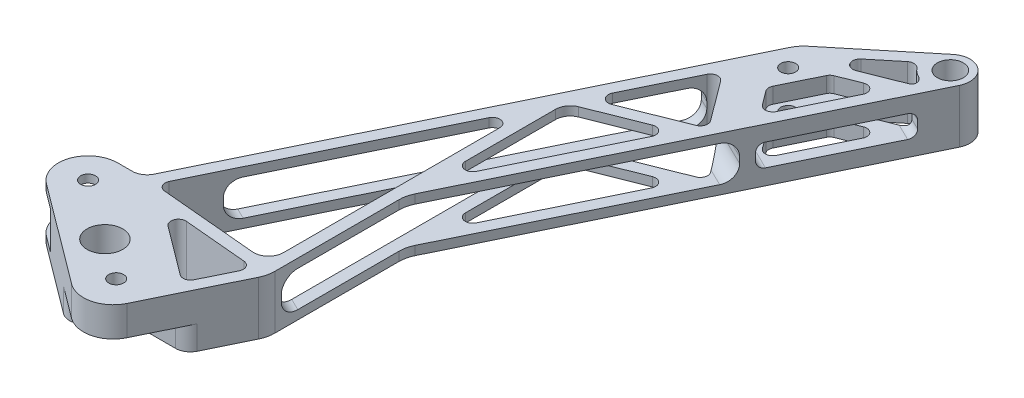
from build123d import *

# Parameters (mm, degrees)
SKETCH1_R               = 3.175
SKETCH1_R_2             = 5.5372
BOSS_EXTRUDE1_DEPTH     = 22.86
CUT_EXTRUDE1_DEPTH      = 8.059928
CUT_EXTRUDE2_DEPTH      = 10.16
CUT_EXTRUDE4_DEPTH      = 282.653637116
CUT_EXTRUDE4_DEPTH_BACK = 282.653637116
SKETCH10_R              = 7.62
FILLET1_R               = 3.175
FILLET2_R               = 12.7
SKETCH11_W              = 154.431730967
SKETCH11_H              = 15.24
CUT_EXTRUDE5_DEPTH      = 111.76
FILLET5_R               = 6.35
SKETCH12_W              = 51.766158773
SKETCH12_H              = 9.525
CUT_EXTRUDE6_DEPTH      = 43.18
FILLET8_R               = 6.35
FILLET7_R               = 6.35
FILLET4_R               = 3.175


with BuildPart() as part:
    # Sketch1 → Boss-Extrude1 (new body)
    with BuildSketch(Plane(origin=(0, 0, 0), x_dir=(1, 0, 0), z_dir=(0, 1, 0))):
        with BuildLine():
            Line((-80.589923656, 44.45), (-70.440646012, 44.45))
            Line((-70.440646012, 44.45), (21.397610809, 233.122630111))
            Line((21.397610809, 233.122630111), (57.58321106, 262.870731575))
            ThreePointArc((57.58321106, 262.870731575), (68.054170152, 262.976534601), (70.39009169, 252.768907592))
            Line((70.39009169, 252.768907592), (-6.976218517, 93.827462773))
            Line((-6.976218517, 93.827462773), (-6.976218517, 34.923071285))
            Line((-6.976218517, 34.923071285), (-26.68094252, -5.558338445))
            ThreePointArc((-26.68094252, -5.558338445), (-35.105440841, -12.341904855), (-45.701991473, -10.173481491))
            Line((-45.701991473, -10.173481491), (-88.191915129, 21.576518509))
            ThreePointArc((-88.191915129, 21.576518509), (-92.641753702, 35.755420394), (-80.589923656, 44.45))
        make_face()
        with Locations(Location((-80.589923656, 31.75, 0), (0, 0, 270))):
            Circle(SKETCH1_R, mode=Mode.SUBTRACT)
        with Locations(Location((27.324381978, 222.747274088, 0), (0, 0, 270))):
            Circle(SKETCH1_R, mode=Mode.SUBTRACT)
        with Locations(Location((62.884381978, 256.422385554, 0), (0, 0, 270))):
            Circle(SKETCH1_R_2, mode=Mode.SUBTRACT)
        with Locations(Location((-38.1, 1.27, 0), (0, 0, 270))):
            Circle(SKETCH1_R, mode=Mode.SUBTRACT)
    extrude(amount=BOSS_EXTRUDE1_DEPTH)

    # Sketch2 → Cut-Extrude1 (cut, symmetric)
    with BuildSketch(Plane(origin=(0, 11.43, 0), x_dir=(-1, 0, 0), z_dir=(0, -1, 0))):
        Polygon((93.289923656, 16.51), (119.123736833, 16.51), (119.123736833, 65.67419432), (65.349923656, 65.67419432), (65.349923656, 44.45), (65.349923656, 16.51), align=None)
    extrude(amount=CUT_EXTRUDE1_DEPTH, both=True, mode=Mode.SUBTRACT)

    # Sketch4 → Cut-Extrude2 (cut)
    with BuildSketch(Plane(origin=(0, 0, 0), x_dir=(-1, 0, 0), z_dir=(0, -1, 0))):
        with BuildLine():
            Line((38.1, 11.049), (10.895356426, 11.049))
            Line((10.895356426, 11.049), (13.015333537, -21.264348886))
            Line((13.015333537, -21.264348886), (62.52493537, -15.080100936))
            Line((62.52493537, -15.080100936), (45.933580748, 7.123533434))
            ThreePointArc((45.933580748, 7.123533434), (42.481046539, 10.012726819), (38.1, 11.049))
        make_face()
    extrude(amount=-CUT_EXTRUDE2_DEPTH, mode=Mode.SUBTRACT)

    # Sketch10 → Cut-Extrude4 (cut, two sides: drawn at the far end of the back side and taken through both)
    with BuildSketch(Plane(origin=(0, 0, 0), x_dir=(-1, 0, 0), z_dir=(0, -1, 0)).offset(-CUT_EXTRUDE4_DEPTH_BACK)):
        with Locations(Location((55.157266564, 13.505971264, 0), (0, 0, 90))):
            Circle(SKETCH10_R)
        Polygon((-14.646962201, 207.647023349), (4.411562958, 168.493165335), (-32.832080676, 183.27657607), align=None)
        Polygon((6.976218517, 162.009587324), (-27.157299952, 175.558471755), (6.976218517, 105.434528561), align=None)
        Polygon((12.056218517, 152.787975357), (12.056218517, 39.688996738), (64.790792676, 44.45), align=None)
        Polygon((55.498233326, 38.510384262), (12.758160388, 34.651708433), (22.780244725, 14.062325788), align=None)
        with BuildLine():
            Line((-61.612056248, 246.342366346), (-59.962110445, 242.952715618))
            Line((-59.962110445, 242.952715618), (-23.981724677, 228.670739707))
            Line((-23.981724677, 228.670739707), (-53.37792621, 252.837291589))
            ThreePointArc((-53.37792621, 252.837291589), (-56.592200629, 248.445289975), (-61.612056248, 246.342366346))
        make_face()
        Polygon((-38.905525657, 229.12899152), (-56.66456004, 236.178223924), (-38.705073744, 199.282232731), (-30.03379154, 210.902889813), align=None)
    extrude(amount=CUT_EXTRUDE4_DEPTH + CUT_EXTRUDE4_DEPTH_BACK, mode=Mode.SUBTRACT)

    # Fillet1
    # the kernel refuses this fillet: 3.175 mm, written as the material it adds along each edge
    with BuildSketch(Plane(origin=(-55.498233326, 0, -38.510384262), x_dir=(0.8010615347003324, 0, 0.5985820057632439), z_dir=(0, 1, 0))) as fillet1_piece_1:
        with BuildLine():
            CenterArc((FILLET1_R * 3.5327959948, FILLET1_R), FILLET1_R, 121.609594884, 148.390405116)
            Line((FILLET1_R * 3.00866746401, FILLET1_R * 1.85163917431), (0, 0))
            Line((0, 0), (FILLET1_R * 3.5327959948, 0))
        make_face()
    extrude(amount=22.86)
    with BuildSketch(Plane(origin=(-12.758160388, 22.86, -34.651708433), x_dir=(-0.43766444449958003, 0, 0.8991383842439794), z_dir=(0, -1, 0)), Plane(origin=(-64.790792676, 0, -44.45), x_dir=(0.9959492912174563, 0, 0.08991667989559035), z_dir=(0, 1, 0))) as fillet1_piece_2:
        with BuildLine():
            CenterArc((FILLET1_R * 1.44947818144, FILLET1_R), FILLET1_R, 159.203855566, 110.796144434)
            Line((FILLET1_R * 0.514628611192, FILLET1_R * 1.35504405501), (0, 0))
            Line((0, 0), (FILLET1_R * 1.44947818144, 0))
        make_face()
    extrude(amount=22.86)
    with BuildSketch(Plane(origin=(-12.056218517, 0, -152.787975357), x_dir=(-0.43766444449965153, 0, 0.8991383842439447), z_dir=(0, 1, 0)), Plane(origin=(-6.976218517, 0, -105.434528561), x_dir=(0.4376644444995801, 0, -0.8991383842439794), z_dir=(0, 1, 0))) as fillet1_piece_3:
        with BuildLine():
            CenterArc((FILLET1_R * 4.33925672536, FILLET1_R), FILLET1_R, 115.9549582, 154.0450418)
            Line((FILLET1_R * 3.90159228086, FILLET1_R * 1.89913838424), (0, 0))
            Line((0, 0), (FILLET1_R * 4.33925672536, 0))
        make_face()
    extrude(amount=22.86)
    with BuildSketch(Plane(origin=(27.157299952, 22.86, -175.558471755), x_dir=(-0.43766444449958014, 0, 0.8991383842439794), z_dir=(0, -1, 0)), Plane(origin=(56.66456004, 22.86, -236.178223924), x_dir=(-0.4376644444995795, 0, 0.8991383842439797), z_dir=(0, -1, 0))) as fillet1_piece_4:
        with BuildLine():
            CenterArc((FILLET1_R * 2.57848482078, FILLET1_R), FILLET1_R, 132.3950418, 137.6049582)
            Line((FILLET1_R * 1.90424633937, FILLET1_R * 1.73851368991), (0, 0))
            Line((0, 0), (FILLET1_R * 2.57848482078, 0))
        make_face()
    extrude(amount=22.86)
    with BuildSketch(Plane(origin=(14.646962201, 22.86, -207.647023349), x_dir=(-0.4376644444995807, 0, 0.8991383842439792), z_dir=(0, -1, 0)), Plane(origin=(38.705073744, 22.86, -199.282232731), x_dir=(0.4376644444995798, 0, -0.8991383842439795), z_dir=(0, -1, 0))) as fillet1_piece_5:
        with BuildLine():
            CenterArc((FILLET1_R * 1.64196311223, -FILLET1_R), FILLET1_R, 90, 117.314906878)
            Line((FILLET1_R * 0.75346523839, -FILLET1_R * 1.45888073415), (0, 0))
            Line((0, 0), (FILLET1_R * 1.64196311223, 0))
        make_face()
    extrude(amount=22.86)
    with BuildSketch(Plane(origin=(32.832080676, 22.86, -183.27657607), x_dir=(-0.5980467610887682, 0, -0.8014612102598814), z_dir=(0, -1, 0))) as fillet1_piece_6:
        with BuildLine():
            CenterArc((FILLET1_R * 1.30511410765, -FILLET1_R), FILLET1_R, 90, 105.080134922)
            Line((FILLET1_R * 0.339551215013, -FILLET1_R * 1.26016975299), (0, 0))
            Line((0, 0), (FILLET1_R * 1.30511410765, 0))
        make_face()
    extrude(amount=22.86)
    with BuildSketch(Plane(origin=(-4.411562958, 0, -168.493165335), x_dir=(0.43766444449958, 0, -0.8991383842439794), z_dir=(0, 1, 0))) as fillet1_piece_7:
        with BuildLine():
            CenterArc((FILLET1_R * 2.57848482078, -FILLET1_R), FILLET1_R, 90, 137.6049582)
            Line((FILLET1_R * 1.90424633937, -FILLET1_R * 1.73851368991), (0, 0))
            Line((0, 0), (FILLET1_R * 2.57848482078, 0))
        make_face()
    extrude(amount=22.86)
    with BuildSketch(Plane(origin=(-22.780244725, 0, -14.062325788), x_dir=(0.4376644444995798, 0, -0.8991383842439795), z_dir=(0, 1, 0))) as fillet1_piece_8:
        with BuildLine():
            CenterArc((FILLET1_R * 1.20908127799, FILLET1_R), FILLET1_R, 169.18654955, 100.81345045)
            Line((FILLET1_R * 0.226838042957, FILLET1_R * 1.1876119059), (0, 0))
            Line((0, 0), (FILLET1_R * 1.20908127799, 0))
        make_face()
    extrude(amount=22.86)
    with BuildSketch(Plane(origin=(59.962110445, 22.86, -242.952715618), x_dir=(0.43766444449958136, 0, -0.8991383842439788), z_dir=(0, -1, 0))) as fillet1_piece_9:
        with BuildLine():
            CenterArc((FILLET1_R * 0.387824660413, -FILLET1_R), FILLET1_R, 90, 42.3950418)
            Line((-FILLET1_R * 0.286413820999, -FILLET1_R * 0.261486310091), (0, 0))
            Line((0, 0), (FILLET1_R * 0.387824660413, 0))
        make_face()
    extrude(amount=22.86)
    with BuildSketch(Plane(origin=(53.37792621, 0, -252.837291589), x_dir=(0.49763977828334227, 0, 0.8673837968685524), z_dir=(0, 1, 0)), Plane(origin=(61.612056248, 22.86, -246.342366346), x_dir=(-0.9594351985797201, 0, -0.2819292459577281), z_dir=(0, -1, 0))) as fillet1_piece_10:
        with BuildLine():
            CenterArc((3.748881914, -3.134322208), FILLET1_R, 99.181406679, 90.398169584)
            Line((0.618155952, -3.662697029), (0, 0))
            ThreePointArc((0, 0), (1.621138125, -0.130168936), (3.24227625, 0))
        make_face()
    extrude(amount=22.86)
    with BuildSketch(Plane(origin=(23.981724677, 0, -228.670739707), x_dir=(0.9294548826213175, 0, -0.3689357954595799), z_dir=(0, 1, 0))) as fillet1_piece_11:
        with BuildLine():
            CenterArc((FILLET1_R * 6.39552501083, FILLET1_R), FILLET1_R, 107.773547716, 162.226452284)
            Line((FILLET1_R * 6.09026931702, FILLET1_R * 1.95227042451), (0, 0))
            Line((0, 0), (FILLET1_R * 6.39552501083, 0))
        make_face()
    extrude(amount=22.86)
    with BuildSketch(Plane(origin=(30.03379154, 0, -210.902889813), x_dir=(0.5980467610887678, 0, 0.8014612102598817), z_dir=(0, 1, 0))) as fillet1_piece_12:
        with BuildLine():
            CenterArc((FILLET1_R * 0.609027080176, FILLET1_R), FILLET1_R, 207.314906878, 62.685093122)
            Line((-FILLET1_R * 0.279470793669, FILLET1_R * 0.541119265849), (0, 0))
            Line((0, 0), (FILLET1_R * 0.609027080176, 0))
        make_face()
    extrude(amount=22.86)
    with BuildSketch(Plane(origin=(38.905525657, 0, -229.12899152), x_dir=(-0.4376644444995767, 0, 0.8991383842439811), z_dir=(0, 1, 0))) as fillet1_piece_13:
        with BuildLine():
            CenterArc((FILLET1_R * 0.387824660413, FILLET1_R), FILLET1_R, 227.6049582, 42.3950418)
            Line((-FILLET1_R * 0.286413820999, FILLET1_R * 0.261486310091), (0, 0))
            Line((0, 0), (FILLET1_R * 0.387824660413, 0))
        make_face()
    extrude(amount=22.86)

    # Fillet2
    fillet2_edges = [part.edges().sort_by_distance(p)[0] for p in [
        (21.397610809, 11.43, -233.122630111),
        (-6.976218517, 11.43, -93.827462773),
        (-6.976218517, 11.43, -34.923071285),
    ]]
    fillet(fillet2_edges, radius=FILLET2_R)

    # Sketch11 → Cut-Extrude5 (cut)
    with BuildSketch(Plane(origin=(-74.439732647, 0, -36.234271396), x_dir=(-0.4376644444995802, 0, 0.8991383842439794), z_dir=(-0.8991383842439795, 0, -0.43766444449958025))):
        with Locations((-110.684765278, 11.43)):
            Rectangle(SKETCH11_W, SKETCH11_H)
    extrude(amount=-CUT_EXTRUDE5_DEPTH, mode=Mode.SUBTRACT)

    # Fillet5
    # the kernel refuses this fillet: 6.35 mm, written as the material it adds along each edge
    with BuildSketch(Plane(origin=(-59.791585211, 19.05, -66.327443879), x_dir=(0, -1, 0), z_dir=(0.8991383842439794, 0, 0.43766444449958025)), Plane(origin=(-59.791585211, 3.81, -66.327443879), x_dir=(0.43766444449958025, 0, -0.8991383842439794), z_dir=(0.8991383842439794, 0, 0.43766444449958025)), Plane(origin=(7.797692536, 3.81, -205.182940937), x_dir=(0, 1, 0), z_dir=(0.8991383842439794, 0, 0.43766444449958025))) as fillet5_piece_1:
        with BuildLine():
            CenterArc((FILLET5_R, FILLET5_R), FILLET5_R, 180, 90)
            Line((0, FILLET5_R), (0, 0))
            Line((0, 0), (FILLET5_R, 0))
        make_face()
    extrude(amount=5.08)
    with BuildSketch(Plane(origin=(7.797692536, 19.05, -205.182940937), x_dir=(0, -1, 0), z_dir=(0.8991383842439794, 0, 0.43766444449958025))) as fillet5_piece_2:
        with BuildLine():
            CenterArc((FILLET5_R, -FILLET5_R), FILLET5_R, 90, 90)
            Line((0, -FILLET5_R), (0, 0))
            Line((0, 0), (FILLET5_R, 0))
        make_face()
    extrude(amount=5.08)
    with BuildSketch(Plane(origin=(-6.476129314, 19.05, -212.130863994), x_dir=(0, -1, 0), z_dir=(0.8991383842439794, 0, 0.43766444449958025))) as fillet5_piece_3_section:
        with BuildLine():
            CenterArc((FILLET5_R, -FILLET5_R), FILLET5_R, 90, 90)
            Line((0, -FILLET5_R), (0, 0))
            Line((0, 0), (FILLET5_R, 0))
        make_face()
    fillet5_piece_3 = extrude(amount=36.83, mode=Mode.PRIVATE)
    fillet5_piece_3 = split(fillet5_piece_3, bisect_by=Plane(origin=(23.562712539, 17.205322892, -195.698746858), z_dir=(0.8014612102598819, 0, -0.5980467610887676)), keep=Keep.TOP, mode=Mode.PRIVATE)
    add(fillet5_piece_3)
    with BuildSketch(Plane(origin=(-6.476129314, 3.81, -212.130863994), x_dir=(0, 1, 0), z_dir=(0.8991383842439794, 0, 0.43766444449958025))) as fillet5_piece_4_section:
        with BuildLine():
            CenterArc((FILLET5_R, FILLET5_R), FILLET5_R, 180, 90)
            Line((0, FILLET5_R), (0, 0))
            Line((0, 0), (FILLET5_R, 0))
        make_face()
    fillet5_piece_4 = extrude(amount=36.83, mode=Mode.PRIVATE)
    fillet5_piece_4 = split(fillet5_piece_4, bisect_by=Plane(origin=(23.562712539, 5.654677108, -195.698746858), z_dir=(0.8014612102598819, 0, -0.5980467610887676)), keep=Keep.TOP, mode=Mode.PRIVATE)
    add(fillet5_piece_4)
    with BuildSketch(Plane(origin=(7.167404759, 19.05, -205.489739707), x_dir=(-0.4376644444995802, 0, 0.8991383842439794), z_dir=(0.8991383842439794, 0, 0.43766444449958025))) as fillet5_piece_5_section:
        with BuildLine():
            CenterArc((FILLET5_R, FILLET5_R), FILLET5_R, 180, 90)
            Line((0, FILLET5_R), (0, 0))
            Line((0, 0), (FILLET5_R, 0))
        make_face()
    fillet5_piece_5 = extrude(amount=52.028533826, mode=Mode.PRIVATE)
    fillet5_piece_5 = split(fillet5_piece_5, bisect_by=Plane(origin=(7.176915235, 17.631613588, -203.90761527), z_dir=(0.8991383842439794, 0, 0.4376644444995802)), keep=Keep.TOP, mode=Mode.PRIVATE)
    fillet5_piece_5 = split(fillet5_piece_5, bisect_by=Plane(origin=(11.744538227, 17.631613588, -201.684279892), z_dir=(-0.8991383842439794, 0, -0.4376644444995802)), keep=Keep.TOP, mode=Mode.PRIVATE)
    add(fillet5_piece_5)
    with BuildSketch(Plane(origin=(7.167404759, 19.05, -205.489739707), x_dir=(-0.4376644444995802, 0, 0.8991383842439794), z_dir=(0.8991383842439794, 0, 0.43766444449958025))) as fillet5_piece_6_section:
        with BuildLine():
            CenterArc((FILLET5_R, FILLET5_R), FILLET5_R, 180, 90)
            Line((0, FILLET5_R), (0, 0))
            Line((0, 0), (FILLET5_R, 0))
        make_face()
    fillet5_piece_6 = extrude(amount=36.153533826, mode=Mode.PRIVATE)
    fillet5_piece_6 = split(fillet5_piece_6, bisect_by=Plane(origin=(27.824250166, 17.539507709, -189.987726707), z_dir=(0.8014612102598819, 0, -0.5980467610887676)), keep=Keep.TOP, mode=Mode.PRIVATE)
    add(fillet5_piece_6)
    with BuildSketch(Plane(origin=(7.167404759, 3.81, -205.489739707), x_dir=(-0.4376644444995802, 0, 0.8991383842439793), z_dir=(0.8991383842439794, 0, 0.43766444449958025))) as fillet5_piece_7_section:
        with BuildLine():
            CenterArc((FILLET5_R, -FILLET5_R), FILLET5_R, 90, 90)
            Line((0, -FILLET5_R), (0, 0))
            Line((0, 0), (FILLET5_R, 0))
        make_face()
    fillet5_piece_7 = extrude(amount=52.028533826, mode=Mode.PRIVATE)
    fillet5_piece_7 = split(fillet5_piece_7, bisect_by=Plane(origin=(7.176915235, 5.228386412, -203.90761527), z_dir=(0.8991383842439794, 0, 0.4376644444995802)), keep=Keep.TOP, mode=Mode.PRIVATE)
    fillet5_piece_7 = split(fillet5_piece_7, bisect_by=Plane(origin=(11.744538227, 5.228386412, -201.684279892), z_dir=(-0.8991383842439794, 0, -0.4376644444995802)), keep=Keep.TOP, mode=Mode.PRIVATE)
    add(fillet5_piece_7)
    with BuildSketch(Plane(origin=(7.167404759, 3.81, -205.489739707), x_dir=(-0.4376644444995802, 0, 0.8991383842439793), z_dir=(0.8991383842439794, 0, 0.43766444449958025))) as fillet5_piece_8_section:
        with BuildLine():
            CenterArc((FILLET5_R, -FILLET5_R), FILLET5_R, 90, 90)
            Line((0, -FILLET5_R), (0, 0))
            Line((0, 0), (FILLET5_R, 0))
        make_face()
    fillet5_piece_8 = extrude(amount=36.153533826, mode=Mode.PRIVATE)
    fillet5_piece_8 = split(fillet5_piece_8, bisect_by=Plane(origin=(27.824250166, 5.320492291, -189.987726707), z_dir=(0.8014612102598819, 0, -0.5980467610887676)), keep=Keep.TOP, mode=Mode.PRIVATE)
    add(fillet5_piece_8)
    with BuildSketch(Plane(origin=(-12.056218517, 22.86, -39.688996738), x_dir=(0, 0, -1), z_dir=(0, -1, 0))) as fillet5_piece_9_section:
        with BuildLine():
            CenterArc((FILLET5_R * 1.09434957132, -FILLET5_R), FILLET5_R, 90, 95.158813766)
            Line((FILLET5_R * 0.0984002800978, -FILLET5_R * 1.0899166799), (0, 0))
            Line((0, 0), (FILLET5_R * 1.09434957132, 0))
        make_face()
    fillet5_piece_9 = extrude(amount=40.232799445, mode=Mode.PRIVATE)
    fillet5_piece_9 = split(fillet5_piece_9, bisect_by=Plane(origin=(-12.307720655, 19.05, -44.120451673), z_dir=(0, 1, 0)), keep=Keep.TOP, mode=Mode.PRIVATE)
    add(fillet5_piece_9)
    with BuildSketch(Plane(origin=(-12.056218517, 40.232799445, -39.688996738), x_dir=(0, 0, -1), z_dir=(0, -1, 0))) as fillet5_piece_10_section:
        with BuildLine():
            CenterArc((FILLET5_R * 1.09434957132, -FILLET5_R), FILLET5_R, 90, 95.158813766)
            Line((FILLET5_R * 0.0984002800978, -FILLET5_R * 1.0899166799), (0, 0))
            Line((0, 0), (FILLET5_R * 1.09434957132, 0))
        make_face()
    fillet5_piece_10 = extrude(amount=40.232799445, mode=Mode.PRIVATE)
    fillet5_piece_10 = split(fillet5_piece_10, bisect_by=Plane(origin=(-13.762155256, 19.05, -41.117735426), z_dir=(0, -1, 0)), keep=Keep.TOP, mode=Mode.PRIVATE)
    fillet5_piece_10 = split(fillet5_piece_10, bisect_by=Plane(origin=(-12.658553008, 11.43, -43.384977271), z_dir=(-0.43766444449958025, 0, 0.8991383842439794)), keep=Keep.TOP, mode=Mode.PRIVATE)
    add(fillet5_piece_10)
    with BuildSketch(Plane(origin=(-12.056218517, 40.232799445, -39.688996738), x_dir=(0, 0, -1), z_dir=(0, -1, 0))) as fillet5_piece_11_section:
        with BuildLine():
            CenterArc((FILLET5_R * 1.09434957132, -FILLET5_R), FILLET5_R, 90, 95.158813766)
            Line((FILLET5_R * 0.0984002800978, -FILLET5_R * 1.0899166799), (0, 0))
            Line((0, 0), (FILLET5_R * 1.09434957132, 0))
        make_face()
    fillet5_piece_11 = extrude(amount=40.232799445, mode=Mode.PRIVATE)
    fillet5_piece_11 = split(fillet5_piece_11, bisect_by=Plane(origin=(-12.307720655, 3.81, -44.120451673), z_dir=(0, -1, 0)), keep=Keep.TOP, mode=Mode.PRIVATE)
    add(fillet5_piece_11)
    with BuildSketch(Plane(origin=(-6.976218517, 19.05, -162.009587324), x_dir=(0.9294548826213174, 0, -0.36893579545958005), z_dir=(0, 1, 0)), Plane(origin=(-6.976218517, 0, -162.009587324), x_dir=(0.9294548826213174, 0, -0.36893579545958005), z_dir=(0, 1, 0))) as fillet5_piece_12:
        with BuildLine():
            CenterArc((FILLET5_R * 0.678961632608, -FILLET5_R), FILLET5_R, 90, 68.35)
            Line((-FILLET5_R * 0.250493250013, -FILLET5_R * 0.63106420454), (0, 0))
            Line((0, 0), (FILLET5_R * 0.678961632608, 0))
        make_face()
    extrude(amount=3.81)

    # Sketch12 → Cut-Extrude6 (cut)
    with BuildSketch(Plane(origin=(-74.439732647, 0, -36.234271396), x_dir=(-0.4376644444995802, 0, 0.8991383842439794), z_dir=(-0.8991383842439795, 0, -0.43766444449958025))):
        with Locations((-218.863710148, 11.43)):
            Rectangle(SKETCH12_W, SKETCH12_H)
    extrude(amount=-CUT_EXTRUDE6_DEPTH, mode=Mode.SUBTRACT)

    # Fillet8
    fillet8_edges = [part.edges().sort_by_distance(p)[0] for p in [
        (-54.144538517, 5.08, 3.864906526),
    ]]
    fillet(fillet8_edges, radius=FILLET8_R)

    # Fillet7
    fillet7_edges = [part.edges().sort_by_distance(p)[0] for p in [
        (-18.597157329, 5.08, -11.049),
        (-70.440646012, 1.685036, -44.45),
        (-70.440646012, 21.174964, -44.45),
        (-9.932001658, 19.05, -42.057801607),
        (-9.932001658, 3.81, -42.057801607),
        (-65.349923656, 11.43, -16.51),
    ]]
    fillet(fillet7_edges, radius=FILLET7_R)

    # Fillet4
    fillet4_edges = [part.edges().sort_by_distance(p)[0] for p in [
        (62.168652015, 6.6675, -241.940267257),
        (62.168652015, 16.1925, -241.940267257),
        (45.809345432, 6.6675, -249.903320502),
        (45.809345432, 16.1925, -249.903320502),
        (25.95939902, 6.6675, -201.992405165),
        (25.95939902, 16.1925, -201.992405165),
    ]]
    fillet(fillet4_edges, radius=FILLET4_R)


solid = part.part
